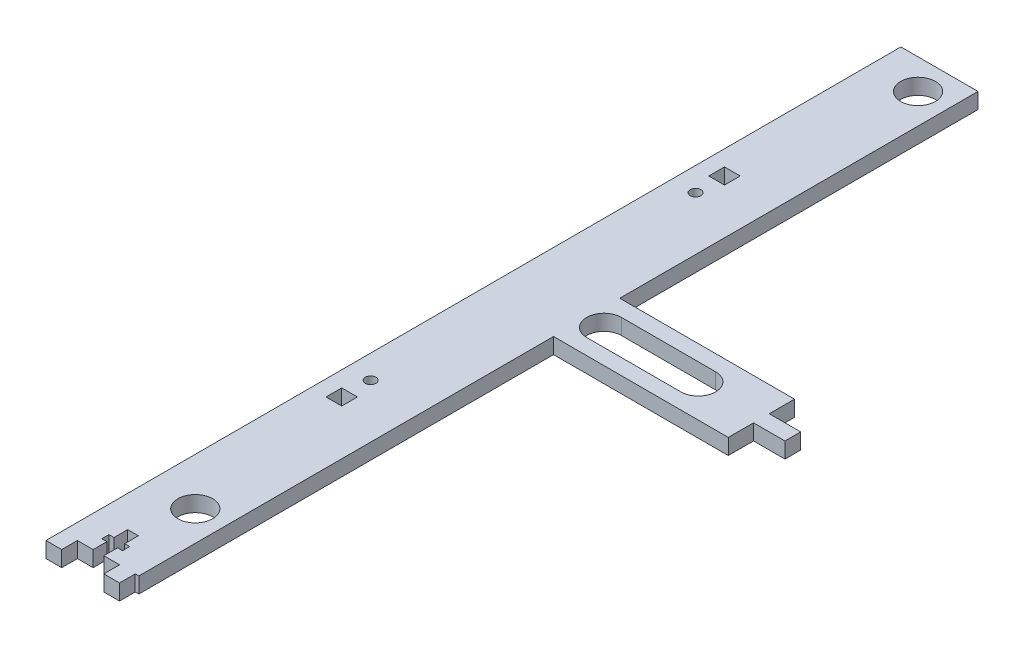
from build123d import *

# Parameters (mm, degrees)
AXLE_SUPPORT_PLATE_R   = 7.030128061
AXLE_SUPPORT_PLATE_R_2 = 2.159
AXLE_SUPPORT_PLATE_W   = 6.35
AXLE_SUPPORT_PLATE_H   = 6.35
BOSS_EXTRUDE1_DEPTH    = 6.35


with BuildPart() as part:
    # Axle Support Plate → Boss-Extrude1 (new body)
    with BuildSketch(Plane(origin=(0, 0, 0), x_dir=(1, 0, 0), z_dir=(0, 1, 0))):
        Polygon((31.160128061, -180.975), (31.160128061, -13.380128061), (101.780512242, -13.380128061), (101.780512242, -3.175), (114.480512242, -3.175), (114.480512242, 3.175), (101.780512242, 3.175), (101.780512242, 13.380128061), (31.160128061, 13.380128061), (31.160128061, 158.160128061), (0, 158.160128061), (0, -187.325), (6.35, -187.325), (6.35, -180.975), (12.7, -180.975), (12.7, -175.440000021), (10.659000018, -175.440000021), (10.659000018, -172.539999979), (12.7, -172.539999979), (12.7, -167.005), (17.018, -167.005), (17.018, -172.539999979), (19.058999982, -172.539999979), (19.058999982, -175.440000021), (17.018, -175.440000021), (17.018, -180.975), (23.368, -180.975), (23.368, -187.325), (29.718, -187.325), (29.718, -180.975), align=None)
        with Locations((19.05, 146.05)):
            Circle(AXLE_SUPPORT_PLATE_R, mode=Mode.SUBTRACT)
        with Locations((19.05, -146.05)):
            Circle(AXLE_SUPPORT_PLATE_R, mode=Mode.SUBTRACT)
        with Locations((9.525, 65.659)):
            Circle(AXLE_SUPPORT_PLATE_R_2, mode=Mode.SUBTRACT)
        with Locations((9.525, -65.659)):
            Circle(AXLE_SUPPORT_PLATE_R_2, mode=Mode.SUBTRACT)
        with Locations((9.525, -77.343)):
            Rectangle(AXLE_SUPPORT_PLATE_W, AXLE_SUPPORT_PLATE_H, mode=Mode.SUBTRACT)
        with Locations((9.525, 77.343)):
            Rectangle(AXLE_SUPPORT_PLATE_W, AXLE_SUPPORT_PLATE_H, mode=Mode.SUBTRACT)
        with BuildLine():
            Line((38.190256121, 7.030128061), (76.290256121, 7.030128061))
            ThreePointArc((76.290256121, 7.030128061), (83.320384182, 0), (76.290256121, -7.030128061))
            Line((76.290256121, -7.030128061), (38.190256121, -7.030128061))
            ThreePointArc((38.190256121, -7.030128061), (31.160128061, 0), (38.190256121, 7.030128061))
        make_face(mode=Mode.SUBTRACT)
    extrude(amount=BOSS_EXTRUDE1_DEPTH)


solid = part.part
